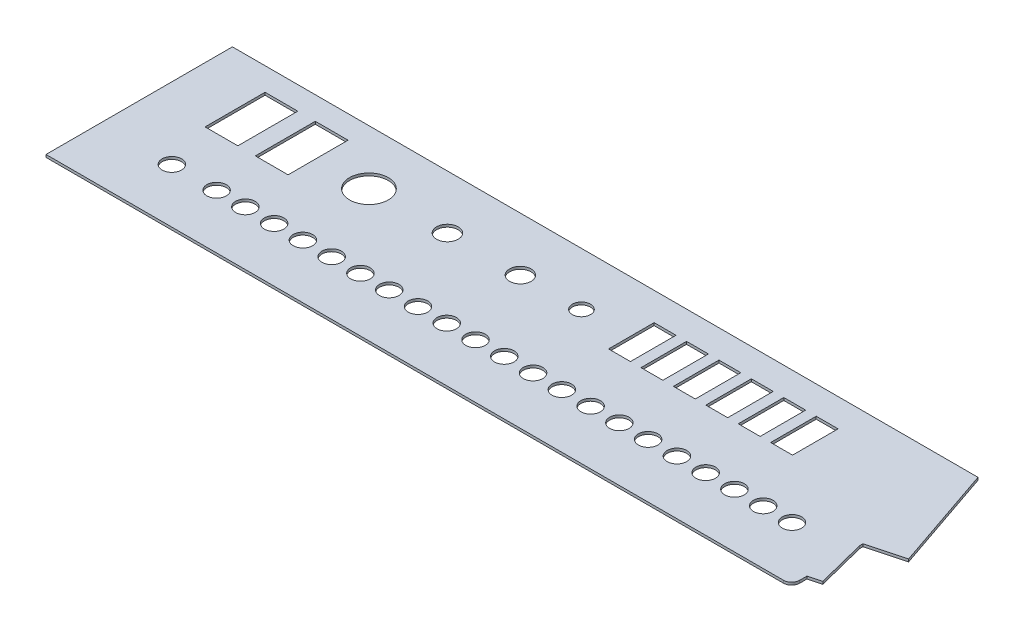
from build123d import *

# Parameters (mm, degrees)
SKETCH4_R           = 11.95
SKETCH4_R_2         = 6.65
SKETCH4_R_3         = 5.6
SKETCH4_R_4         = 6
SKETCH4_W           = 20.218579234
SKETCH4_H           = 37
SKETCH4_W_2         = 13.5
SKETCH4_H_2         = 28.1
BOSS_EXTRUDE3_DEPTH = 1.6


with BuildPart() as part:
    # Sketch4 → Boss-Extrude3 (new body)
    with BuildSketch(Plane(origin=(0, 0, 0), x_dir=(1, 0, 0), z_dir=(0, 1, 0))):
        with BuildLine():
            Line((-63.047420146, 63.390203379), (-63.047420146, -51.609796621))
            Line((-63.047420146, -51.609796621), (391.952579854, -51.609796621))
            ThreePointArc((391.952579854, -51.609796621), (395.48811376, -50.145330527), (396.952579854, -46.609796621))
            Line((396.952579854, -46.609796621), (396.952579854, -42.187494758))
            Line((396.952579854, -42.187494758), (404.679986464, -40.116942397))
            Line((404.679986464, -40.116942397), (396.952579854, -9.609796621))
            Line((396.952579854, -9.609796621), (396.952579854, -7.609796621))
            Line((396.952579854, -7.609796621), (419.168873859, -1.656958583))
            Line((419.168873859, -1.656958583), (396.952579854, 63.390203379))
            Line((396.952579854, 63.390203379), (-63.047420146, 63.390203379))
        make_face()
        with Locations((54.9, 29.690203379)):
            Circle(SKETCH4_R, mode=Mode.SUBTRACT)
        with Locations((102.75, 30.240203379)):
            Circle(SKETCH4_R_2, mode=Mode.SUBTRACT)
        with Locations((147.75, 30.240203379)):
            Circle(SKETCH4_R_2, mode=Mode.SUBTRACT)
        with Locations((184.9, 30.790203379)):
            Circle(SKETCH4_R_3, mode=Mode.SUBTRACT)
        with Locations((-18.9, -18.109796621)):
            Circle(SKETCH4_R_4, mode=Mode.SUBTRACT)
        with Locations((8.7, -18.109796621)):
            Circle(SKETCH4_R_4, mode=Mode.SUBTRACT)
        with Locations((26.45, -18.109796621)):
            Circle(SKETCH4_R_4, mode=Mode.SUBTRACT)
        with Locations((44.2, -18.109796621)):
            Circle(SKETCH4_R_4, mode=Mode.SUBTRACT)
        with Locations((61.95, -18.109796621)):
            Circle(SKETCH4_R_4, mode=Mode.SUBTRACT)
        with Locations((79.7, -18.109796621)):
            Circle(SKETCH4_R_4, mode=Mode.SUBTRACT)
        with Locations((97.45, -18.109796621)):
            Circle(SKETCH4_R_4, mode=Mode.SUBTRACT)
        with Locations((115.2, -18.109796621)):
            Circle(SKETCH4_R_4, mode=Mode.SUBTRACT)
        with Locations((132.95, -18.109796621)):
            Circle(SKETCH4_R_4, mode=Mode.SUBTRACT)
        with Locations((150.7, -18.109796621)):
            Circle(SKETCH4_R_4, mode=Mode.SUBTRACT)
        with Locations((168.45, -18.109796621)):
            Circle(SKETCH4_R_4, mode=Mode.SUBTRACT)
        with Locations((186.2, -18.109796621)):
            Circle(SKETCH4_R_4, mode=Mode.SUBTRACT)
        with Locations((203.95, -18.109796621)):
            Circle(SKETCH4_R_4, mode=Mode.SUBTRACT)
        with Locations((221.7, -18.109796621)):
            Circle(SKETCH4_R_4, mode=Mode.SUBTRACT)
        with Locations((239.45, -18.109796621)):
            Circle(SKETCH4_R_4, mode=Mode.SUBTRACT)
        with Locations((257.2, -18.109796621)):
            Circle(SKETCH4_R_4, mode=Mode.SUBTRACT)
        with Locations((274.95, -18.109796621)):
            Circle(SKETCH4_R_4, mode=Mode.SUBTRACT)
        with Locations((292.7, -18.109796621)):
            Circle(SKETCH4_R_4, mode=Mode.SUBTRACT)
        with Locations((310.45, -18.109796621)):
            Circle(SKETCH4_R_4, mode=Mode.SUBTRACT)
        with Locations((328.2, -18.109796621)):
            Circle(SKETCH4_R_4, mode=Mode.SUBTRACT)
        with Locations((345.95, -18.109796621)):
            Circle(SKETCH4_R_4, mode=Mode.SUBTRACT)
        with Locations((363.7, -18.109796621)):
            Circle(SKETCH4_R_4, mode=Mode.SUBTRACT)
        with Locations((-18.6, 30.690203379)):
            Rectangle(SKETCH4_W, SKETCH4_H, mode=Mode.SUBTRACT)
        with Locations((12.4, 30.690203379)):
            Rectangle(SKETCH4_W, SKETCH4_H, mode=Mode.SUBTRACT)
        with Locations((241.15, 32.073143277)):
            Rectangle(SKETCH4_W_2, SKETCH4_H_2, mode=Mode.SUBTRACT)
        with Locations((221.15, 32.073143277)):
            Rectangle(SKETCH4_W_2, SKETCH4_H_2, mode=Mode.SUBTRACT)
        with Locations((261.15, 32.073143277)):
            Rectangle(SKETCH4_W_2, SKETCH4_H_2, mode=Mode.SUBTRACT)
        with Locations((281.15, 32.073143277)):
            Rectangle(SKETCH4_W_2, SKETCH4_H_2, mode=Mode.SUBTRACT)
        with Locations((301.15, 32.073143277)):
            Rectangle(SKETCH4_W_2, SKETCH4_H_2, mode=Mode.SUBTRACT)
        with Locations((321.15, 32.073143277)):
            Rectangle(SKETCH4_W_2, SKETCH4_H_2, mode=Mode.SUBTRACT)
    extrude(amount=BOSS_EXTRUDE3_DEPTH)


solid = part.part
